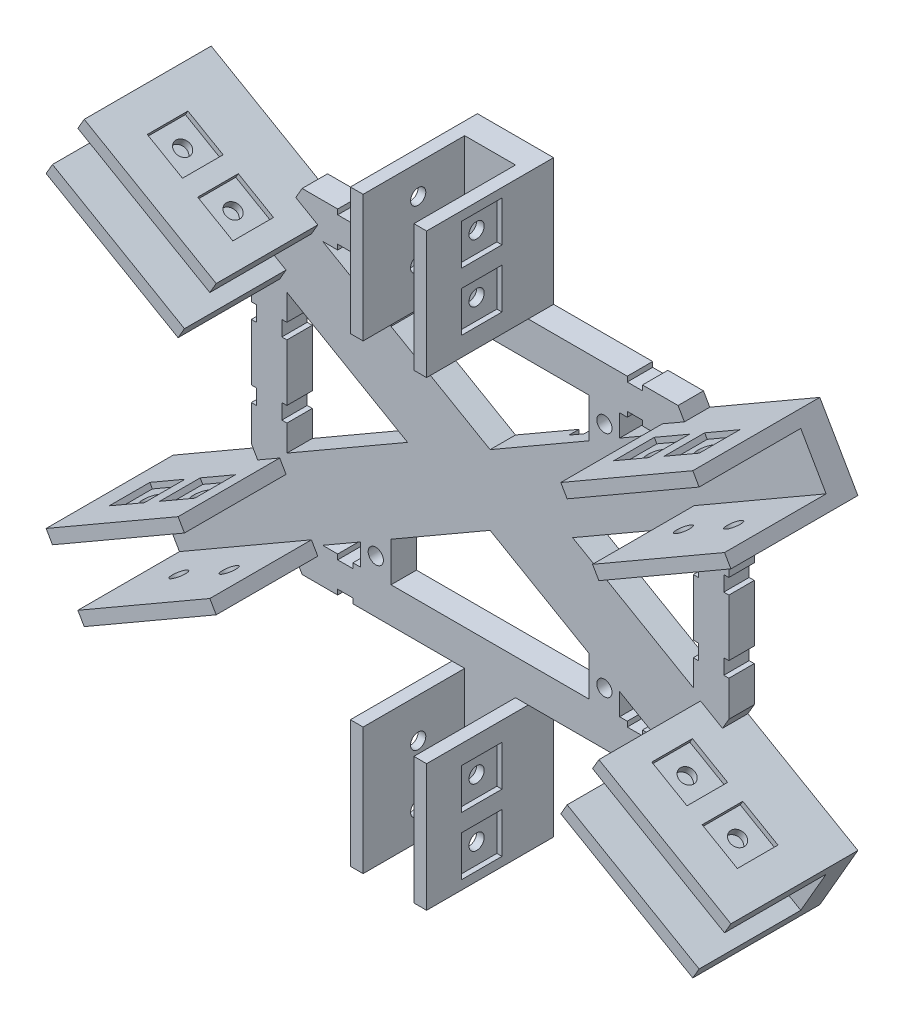
from build123d import *

# Parameters (mm, degrees)
ESQUISSE1_R                = 1.5
BOSS_EXTRU_2_DEPTH         = 5
ENL_V_MAT_EXTRU_2_DEPTH    = 2
ESQUISSE5_W                = 20
ESQUISSE5_H                = 2.5
BOSS_EXTRU_3_DEPTH         = 30
ESQUISSE7_W                = 20
ESQUISSE7_H                = 2.5
BOSS_EXTRU_4_DEPTH         = 30
ESQUISSE8_W                = 8
ESQUISSE8_H                = 8
ENL_V_MAT_EXTRU_3_DEPTH    = 1
ESQUISSE9_W                = 8
ESQUISSE9_H                = 8
ENL_V_MAT_EXTRU_4_DEPTH    = 1
ESQUISSE10_R               = 1.5
ENL_V_MAT_EXTRU_5_DEPTH    = 3
SYM_TRIE5_COPY_1_SKETCH_R  = 1.5
SYM_TRIE5_COPY_1_DEPTH     = 3
SYM_TRIE7_COPY_1_SKETCH_R  = 1.5
SYM_TRIE7_COPY_1_DEPTH     = 3
SYM_TRIE7_COPY_2_SKETCH_W  = 8
SYM_TRIE7_COPY_2_SKETCH_H  = 8
SYM_TRIE7_COPY_2_DEPTH     = 1
SYM_TRIE7_COPY_3_SKETCH_W  = 8
SYM_TRIE7_COPY_3_SKETCH_H  = 8
SYM_TRIE7_COPY_3_DEPTH     = 1
SYM_TRIE7_COPY_4_SKETCH_R  = 1.5
SYM_TRIE7_COPY_4_DEPTH     = 3
SYM_TRIE7_COPY_5_SKETCH_R  = 1.5
SYM_TRIE7_COPY_5_DEPTH     = 3
SYM_TRIE8_COPY_1_SKETCH_R  = 1.5
SYM_TRIE8_COPY_1_DEPTH     = 3
SYM_TRIE8_COPY_2_SKETCH_W  = 8
SYM_TRIE8_COPY_2_SKETCH_H  = 8
SYM_TRIE8_COPY_2_DEPTH     = 1
SYM_TRIE8_COPY_3_SKETCH_W  = 8
SYM_TRIE8_COPY_3_SKETCH_H  = 8
SYM_TRIE8_COPY_3_DEPTH     = 1
SYM_TRIE8_COPY_4_SKETCH_R  = 1.5
SYM_TRIE8_COPY_4_DEPTH     = 3
SYM_TRIE8_COPY_5_SKETCH_R  = 1.5
SYM_TRIE8_COPY_5_DEPTH     = 3
SYM_TRIE8_COPY_6_SKETCH_W  = 20
SYM_TRIE8_COPY_6_SKETCH_H  = 2.5
SYM_TRIE8_COPY_6_DEPTH     = 30
SYM_TRIE8_COPY_7_SKETCH_W  = 20
SYM_TRIE8_COPY_7_SKETCH_H  = 2.5
SYM_TRIE8_COPY_7_DEPTH     = 30
SYM_TRIE8_COPY_8_SKETCH_W  = 8
SYM_TRIE8_COPY_8_SKETCH_H  = 8
SYM_TRIE8_COPY_8_DEPTH     = 1
SYM_TRIE8_COPY_9_SKETCH_W  = 8
SYM_TRIE8_COPY_9_SKETCH_H  = 8
SYM_TRIE8_COPY_9_DEPTH     = 1
SYM_TRIE8_COPY_10_SKETCH_R = 1.5
SYM_TRIE8_COPY_10_DEPTH    = 3
SYM_TRIE8_COPY_11_SKETCH_R = 1.5
SYM_TRIE8_COPY_11_DEPTH    = 3
SYM_TRIE8_COPY_12_SKETCH_W = 8
SYM_TRIE8_COPY_12_SKETCH_H = 8
SYM_TRIE8_COPY_12_DEPTH    = 1
SYM_TRIE8_COPY_13_SKETCH_W = 8
SYM_TRIE8_COPY_13_SKETCH_H = 8
SYM_TRIE8_COPY_13_DEPTH    = 1
SYM_TRIE8_COPY_14_SKETCH_R = 1.5
SYM_TRIE8_COPY_14_DEPTH    = 3
SYM_TRIE8_COPY_15_SKETCH_R = 1.5
SYM_TRIE8_COPY_15_DEPTH    = 3
ESQUISSE11_W               = 2.5
ESQUISSE11_H               = 20
BOSS_EXTRU_5_DEPTH         = 25
ESQUISSE50_W               = 8
ESQUISSE50_H               = 8
ENL_V_MAT_EXTRU_25_DEPTH   = 1
ESQUISSE52_W               = 8
ESQUISSE52_H               = 8
ENL_V_MAT_EXTRU_26_DEPTH   = 1
ESQUISSE54_R               = 1.5
ENL_V_MAT_EXTRU_27_DEPTH   = 3
SYM_TRIE10_COPY_1_SKETCH_R = 1.5
SYM_TRIE10_COPY_1_DEPTH    = 3
SYM_TRIE11_COPY_1_SKETCH_R = 1.5
SYM_TRIE11_COPY_1_DEPTH    = 3
SYM_TRIE11_COPY_2_SKETCH_W = 2.5
SYM_TRIE11_COPY_2_SKETCH_H = 20
SYM_TRIE11_COPY_2_DEPTH    = 25
SYM_TRIE11_COPY_3_SKETCH_W = 8
SYM_TRIE11_COPY_3_SKETCH_H = 8
SYM_TRIE11_COPY_3_DEPTH    = 1
SYM_TRIE11_COPY_4_SKETCH_W = 8
SYM_TRIE11_COPY_4_SKETCH_H = 8
SYM_TRIE11_COPY_4_DEPTH    = 1
SYM_TRIE11_COPY_5_SKETCH_R = 1.5
SYM_TRIE11_COPY_5_DEPTH    = 3
SYM_TRIE11_COPY_6_SKETCH_R = 1.5
SYM_TRIE11_COPY_6_DEPTH    = 3
ENL_V_MAT_EXTRU_28_DEPTH   = 50


with BuildPart() as part:
    # Esquisse1 → Boss.-Extru.2 (new body)
    with BuildSketch(Plane.XY):
        Polygon((-27, -32.908965344), (-27, -31.908965344), (-30, -31.908965344), (-30, -32.908965344), (-37, -32.908965344), (-38.250062729, -30.743793185), (-59.900697824, -43.243793185), (-67.400697824, -30.253412128), (-45.750062729, -17.753412128), (-47, -15.588457268), (-47, -8.588457268), (-46, -8.588457268), (-46, -5.588457268), (-47, -5.588457268), (-47, 5.588457268), (-46, 5.588457268), (-46, 8.588457268), (-47, 8.588457268), (-47, 15.588457268), (-45.750062729, 17.753412128), (-67.400697824, 30.253412128), (-59.900697824, 43.243793185), (-38.250062729, 30.743793185), (-37, 32.908965344), (-30, 32.908965344), (-30, 31.908965344), (-27, 31.908965344), (-27, 32.908965344), (-7.5, 32.908965344), (-7.5, 57.908965344), (7.5, 57.908965344), (7.5, 32.908965344), (27, 32.908965344), (27, 31.908965344), (30, 31.908965344), (30, 32.908965344), (37, 32.908965344), (38.250062729, 30.743793185), (59.900697824, 43.243793185), (67.400697824, 30.253412128), (45.750062729, 17.753412128), (47, 15.588457268), (47, 8.588457268), (46, 8.588457268), (46, 5.588457268), (47, 5.588457268), (47, -5.588457268), (46, -5.588457268), (46, -8.588457268), (47, -8.588457268), (47, -15.588457268), (45.750062729, -17.753412128), (67.400697824, -30.253412128), (59.900697824, -43.243793185), (38.250062729, -30.743793185), (37, -32.908965344), (30, -32.908965344), (30, -31.908965344), (27, -31.908965344), (27, -32.908965344), (7.5, -32.908965344), (7.5, -57.908965344), (-7.5, -57.908965344), (-7.5, -32.908965344), align=None)
        with Locations((22.5, 22.5)):
            Circle(ESQUISSE1_R, mode=Mode.SUBTRACT)
        with Locations((-22.5, 22.5)):
            Circle(ESQUISSE1_R, mode=Mode.SUBTRACT)
        with Locations((22.5, -22.5)):
            Circle(ESQUISSE1_R, mode=Mode.SUBTRACT)
        with Locations((-22.5, -22.5)):
            Circle(ESQUISSE1_R, mode=Mode.SUBTRACT)
        Polygon((-40, 5.588457268), (-40, -5.588457268), (-41, -5.588457268), (-41, -8.588457268), (-40, -8.588457268), (-40, -13.712812921), (-16.248711306, 0), (-40, 13.712812921), (-40, 8.588457268), (-41, 8.588457268), (-41, 5.588457268), align=None, mode=Mode.SUBTRACT)
        Polygon((40, 13.712812921), (16.248711306, 0), (40, -13.712812921), (40, -8.588457268), (41, -8.588457268), (41, -5.588457268), (40, -5.588457268), (40, 5.588457268), (41, 5.588457268), (41, 8.588457268), (40, 8.588457268), align=None, mode=Mode.SUBTRACT)
        Polygon((-32.958548116, -25.908965344), (-30, -25.908965344), (-30, -26.908965344), (-27, -26.908965344), (-27, -25.908965344), (-25.5, -25.908965344), (-25.5, -21.602770581), align=None, mode=Mode.SUBTRACT)
        Polygon((19.5, -25.908965344), (0, -25.908965344), (-19.5, -25.908965344), (-19.5, -18.138668966), (0, -6.880338717), (19.5, -18.138668966), align=None, mode=Mode.SUBTRACT)
        Polygon((-27, 26.908965344), (-27, 25.908965344), (-25.5, 25.908965344), (-25.5, 21.602770581), (-32.958548116, 25.908965344), (-30, 25.908965344), (-30, 26.908965344), align=None, mode=Mode.SUBTRACT)
        Polygon((32.958548116, 25.908965344), (25.5, 21.602770581), (25.5, 25.908965344), (27, 25.908965344), (27, 26.908965344), (30, 26.908965344), (30, 25.908965344), align=None, mode=Mode.SUBTRACT)
        Polygon((27, -26.908965344), (27, -25.908965344), (25.5, -25.908965344), (25.5, -21.602770581), (32.958548116, -25.908965344), (30, -25.908965344), (30, -26.908965344), align=None, mode=Mode.SUBTRACT)
        Polygon((-19.5, 25.908965344), (-19.5, 18.138668966), (0, 6.880338717), (19.5, 18.138668966), (19.5, 25.908965344), (0, 25.908965344), align=None, mode=Mode.SUBTRACT)
    extrude(amount=BOSS_EXTRU_2_DEPTH)

    # Esquisse4 → Enlèv. mat.-Extru.2 (cut)
    with BuildSketch(Plane(origin=(0, 0, 0), x_dir=(-1, 0, 0), z_dir=(0, 0, -1))):
        Polygon((-22.5, 20.142891012), (-20.458683737, 21.321445506), (-20.458683737, 23.678554494), (-22.5, 24.857108988), (-24.541316263, 23.678554494), (-24.541316263, 21.321445506), align=None)
        Polygon((24.541316263, 21.321445506), (22.5, 20.142891012), (20.458683737, 21.321445506), (20.458683737, 23.678554494), (22.5, 24.857108988), (24.541316263, 23.678554494), align=None)
        Polygon((22.5, -20.142891012), (20.458683737, -21.321445506), (20.458683737, -23.678554494), (22.5, -24.857108988), (24.541316263, -23.678554494), (24.541316263, -21.321445506), align=None)
        Polygon((-24.541316263, -21.321445506), (-22.5, -20.142891012), (-20.458683737, -21.321445506), (-20.458683737, -23.678554494), (-22.5, -24.857108988), (-24.541316263, -23.678554494), align=None)
    extrude(amount=-ENL_V_MAT_EXTRU_2_DEPTH, mode=Mode.SUBTRACT)

    # Esquisse5 → Boss.-Extru.3 (add)
    with BuildSketch(Plane(origin=(63.650635095, 36.748711306, 0), x_dir=(0, 0, -1), z_dir=(0.8660254037844382, 0.500000000000001, 0))):
        with Locations((-15, -6.250125458)):
            Rectangle(ESQUISSE5_W, ESQUISSE5_H)
    boss_extru_3 = extrude(amount=-BOSS_EXTRU_3_DEPTH)

    # Esquisse7 → Boss.-Extru.4 (add)
    with BuildSketch(Plane(origin=(63.650635095, 36.748711306, 0), x_dir=(0, 0, -1), z_dir=(0.866025403784438, 0.5000000000000009, 0))):
        with Locations((-15, 6.249874542)):
            Rectangle(ESQUISSE7_W, ESQUISSE7_H)
    boss_extru_4 = extrude(amount=-BOSS_EXTRU_4_DEPTH)

    # Esquisse8 → Enlèv. mat.-Extru.3 (cut)
    with BuildSketch(Plane(origin=(3.750062729, -6.495299178, 0), x_dir=(0.8660254037844448, 0.4999999999999891, 0), z_dir=(0.4999999999999892, -0.8660254037844449, 0))):
        with Locations((51.610954886, 14.155470703)):
            Rectangle(ESQUISSE8_W, ESQUISSE8_H)
    enl_v_mat_extru_3 = extrude(amount=-ENL_V_MAT_EXTRU_3_DEPTH, mode=Mode.SUBTRACT)

    # Esquisse9 → Enlèv. mat.-Extru.4 (cut)
    with BuildSketch(Plane(origin=(3.750062729, -6.495299178, 0), x_dir=(0.8660254037844448, 0.4999999999999891, 0), z_dir=(0.4999999999999892, -0.8660254037844449, 0))):
        with Locations((63.062795122, 14.155470703)):
            Rectangle(ESQUISSE9_W, ESQUISSE9_H)
    enl_v_mat_extru_4 = extrude(amount=-ENL_V_MAT_EXTRU_4_DEPTH, mode=Mode.SUBTRACT)

    # Esquisse10 → Enlèv. mat.-Extru.5 (cut)
    with BuildSketch(Plane(origin=(3.250062729, -5.629273774, 0), x_dir=(0.8660254037844448, 0.49999999999998934, 0), z_dir=(0.4999999999999894, -0.8660254037844449, 0))):
        with Locations((51.610954886, 14.155470703)):
            Circle(ESQUISSE10_R)
    enl_v_mat_extru_5 = extrude(amount=-ENL_V_MAT_EXTRU_5_DEPTH, mode=Mode.SUBTRACT)

    # Symétrie4: Enlèv. mat.-Extru.5 across plane
    add(enl_v_mat_extru_5.mirror(Plane(origin=(49.655190327, 28.668437502, 0), x_dir=(0, 0, 1), z_dir=(-0.8660254037844448, -0.4999999999999891, 0))), mode=Mode.SUBTRACT)

    # Symétrie5: Enlèv. mat.-Extru.3, Enlèv. mat.-Extru.4, Enlèv. mat.-Extru.5 across plane
    add(enl_v_mat_extru_3.mirror(Plane(origin=(6.2729e-05, -0.00010865, 0), x_dir=(0, 0, 1), z_dir=(-0.5000000000000009, 0.8660254037844383, 0))), mode=Mode.SUBTRACT)
    add(enl_v_mat_extru_4.mirror(Plane(origin=(6.2729e-05, -0.00010865, 0), x_dir=(0, 0, 1), z_dir=(-0.5000000000000009, 0.8660254037844383, 0))), mode=Mode.SUBTRACT)
    add(enl_v_mat_extru_5.mirror(Plane(origin=(6.2729e-05, -0.00010865, 0), x_dir=(0, 0, 1), z_dir=(-0.5000000000000009, 0.8660254037844383, 0))), mode=Mode.SUBTRACT)

    # Symétrie5 copy 1 sketch → Symétrie5 copy 1 (cut)
    with BuildSketch(Plane(origin=(96.060443383, 62.965931479, 0), x_dir=(-0.8660254037844315, -0.5000000000000128, 1.001543065824766e-15), z_dir=(-0.500000000000013, 0.8660254037844318, 0))):
        with Locations((51.610954886, 14.155470703)):
            Circle(SYM_TRIE5_COPY_1_SKETCH_R)
    extrude(amount=-SYM_TRIE5_COPY_1_DEPTH, mode=Mode.SUBTRACT)

    # Symétrie7: Boss.-Extru.3, Boss.-Extru.4, Enlèv. mat.-Extru.3, Enlèv. mat.-Extru.4, Enlèv. mat.-Extru.5 across plane
    add(boss_extru_3.mirror(Plane.ZX))
    add(boss_extru_4.mirror(Plane.ZX))
    add(enl_v_mat_extru_3.mirror(Plane.ZX), mode=Mode.SUBTRACT)
    add(enl_v_mat_extru_4.mirror(Plane.ZX), mode=Mode.SUBTRACT)
    add(enl_v_mat_extru_5.mirror(Plane.ZX), mode=Mode.SUBTRACT)

    # Symétrie7 copy 1 sketch → Symétrie7 copy 1 (cut)
    with BuildSketch(Plane(origin=(102.560443383, -51.70760123, 0), x_dir=(-0.866025403784445, 0.49999999999998906, 1.001543065824766e-15), z_dir=(0.4999999999999891, 0.8660254037844451, 0))):
        with Locations((51.610954886, 14.155470703)):
            Circle(SYM_TRIE7_COPY_1_SKETCH_R)
    extrude(amount=-SYM_TRIE7_COPY_1_DEPTH, mode=Mode.SUBTRACT)

    # Symétrie7 copy 2 sketch → Symétrie7 copy 2 (cut)
    with BuildSketch(Plane(origin=(-3.749937271, -6.495081879, 0), x_dir=(0.8660254037844313, -0.5000000000000124, 0), z_dir=(-0.5000000000000128, -0.8660254037844318, 0))):
        with Locations((51.610954886, 14.155470703)):
            Rectangle(SYM_TRIE7_COPY_2_SKETCH_W, SYM_TRIE7_COPY_2_SKETCH_H)
    extrude(amount=-SYM_TRIE7_COPY_2_DEPTH, mode=Mode.SUBTRACT)

    # Symétrie7 copy 3 sketch → Symétrie7 copy 3 (cut)
    with BuildSketch(Plane(origin=(-3.749937271, -6.495081879, 0), x_dir=(0.8660254037844313, -0.5000000000000124, 0), z_dir=(-0.5000000000000128, -0.8660254037844318, 0))):
        with Locations((63.062795122, 14.155470703)):
            Rectangle(SYM_TRIE7_COPY_3_SKETCH_W, SYM_TRIE7_COPY_3_SKETCH_H)
    extrude(amount=-SYM_TRIE7_COPY_3_DEPTH, mode=Mode.SUBTRACT)

    # Symétrie7 copy 4 sketch → Symétrie7 copy 4 (cut)
    with BuildSketch(Plane(origin=(-3.249937271, -5.629056475, 0), x_dir=(0.8660254037844315, -0.5000000000000123, 0), z_dir=(-0.5000000000000127, -0.866025403784432, 0))):
        with Locations((51.610954886, 14.155470703)):
            Circle(SYM_TRIE7_COPY_4_SKETCH_R)
    extrude(amount=-SYM_TRIE7_COPY_4_DEPTH, mode=Mode.SUBTRACT)

    # Symétrie7 copy 5 sketch → Symétrie7 copy 5 (cut)
    with BuildSketch(Plane(origin=(96.060443383, -62.965931479, 0), x_dir=(-0.8660254037844315, 0.5000000000000128, 1.001543065824766e-15), z_dir=(-0.500000000000013, -0.8660254037844318, 0))):
        with Locations((51.610954886, -14.155470703)):
            Circle(SYM_TRIE7_COPY_5_SKETCH_R)
    extrude(amount=-SYM_TRIE7_COPY_5_DEPTH, mode=Mode.SUBTRACT)

    # Symétrie8: Boss.-Extru.3, Boss.-Extru.4, Enlèv. mat.-Extru.3, Enlèv. mat.-Extru.4, Enlèv. mat.-Extru.5 across plane
    add(boss_extru_3.mirror(Plane(origin=(0, 0, 0), x_dir=(0, 0, 1), z_dir=(1, 0, 0))))
    add(boss_extru_4.mirror(Plane(origin=(0, 0, 0), x_dir=(0, 0, 1), z_dir=(1, 0, 0))))
    add(enl_v_mat_extru_3.mirror(Plane(origin=(0, 0, 0), x_dir=(0, 0, 1), z_dir=(1, 0, 0))), mode=Mode.SUBTRACT)
    add(enl_v_mat_extru_4.mirror(Plane(origin=(0, 0, 0), x_dir=(0, 0, 1), z_dir=(1, 0, 0))), mode=Mode.SUBTRACT)
    add(enl_v_mat_extru_5.mirror(Plane(origin=(0, 0, 0), x_dir=(0, 0, 1), z_dir=(1, 0, 0))), mode=Mode.SUBTRACT)

    # Symétrie8 copy 1 sketch → Symétrie8 copy 1 (cut)
    with BuildSketch(Plane(origin=(-102.560443383, 51.70760123, 0), x_dir=(0.866025403784445, -0.49999999999998906, 1.001543065824766e-15), z_dir=(-0.4999999999999891, -0.8660254037844451, 0))):
        with Locations((51.610954886, 14.155470703)):
            Circle(SYM_TRIE8_COPY_1_SKETCH_R)
    extrude(amount=-SYM_TRIE8_COPY_1_DEPTH, mode=Mode.SUBTRACT)

    # Symétrie8 copy 2 sketch → Symétrie8 copy 2 (cut)
    with BuildSketch(Plane(origin=(3.749937271, 6.495081879, 0), x_dir=(-0.8660254037844313, 0.5000000000000124, 0), z_dir=(0.5000000000000128, 0.8660254037844318, 0))):
        with Locations((51.610954886, 14.155470703)):
            Rectangle(SYM_TRIE8_COPY_2_SKETCH_W, SYM_TRIE8_COPY_2_SKETCH_H)
    extrude(amount=-SYM_TRIE8_COPY_2_DEPTH, mode=Mode.SUBTRACT)

    # Symétrie8 copy 3 sketch → Symétrie8 copy 3 (cut)
    with BuildSketch(Plane(origin=(3.749937271, 6.495081879, 0), x_dir=(-0.8660254037844313, 0.5000000000000124, 0), z_dir=(0.5000000000000128, 0.8660254037844318, 0))):
        with Locations((63.062795122, 14.155470703)):
            Rectangle(SYM_TRIE8_COPY_3_SKETCH_W, SYM_TRIE8_COPY_3_SKETCH_H)
    extrude(amount=-SYM_TRIE8_COPY_3_DEPTH, mode=Mode.SUBTRACT)

    # Symétrie8 copy 4 sketch → Symétrie8 copy 4 (cut)
    with BuildSketch(Plane(origin=(3.249937271, 5.629056475, 0), x_dir=(-0.8660254037844315, 0.5000000000000123, 0), z_dir=(0.5000000000000127, 0.866025403784432, 0))):
        with Locations((51.610954886, 14.155470703)):
            Circle(SYM_TRIE8_COPY_4_SKETCH_R)
    extrude(amount=-SYM_TRIE8_COPY_4_DEPTH, mode=Mode.SUBTRACT)

    # Symétrie8 copy 5 sketch → Symétrie8 copy 5 (cut)
    with BuildSketch(Plane(origin=(-96.060443383, 62.965931479, 0), x_dir=(0.8660254037844315, -0.5000000000000128, 1.001543065824766e-15), z_dir=(0.500000000000013, 0.8660254037844318, 0))):
        with Locations((51.610954886, -14.155470703)):
            Circle(SYM_TRIE8_COPY_5_SKETCH_R)
    extrude(amount=-SYM_TRIE8_COPY_5_DEPTH, mode=Mode.SUBTRACT)

    # Symétrie8 copy 6 sketch → Symétrie8 copy 6 (add)
    with BuildSketch(Plane(origin=(-63.650635095, -36.748711306, 0), x_dir=(0, 0, -1), z_dir=(-0.8660254037844382, -0.500000000000001, 0))):
        with Locations((-15, -6.250125458)):
            Rectangle(SYM_TRIE8_COPY_6_SKETCH_W, SYM_TRIE8_COPY_6_SKETCH_H)
    extrude(amount=-SYM_TRIE8_COPY_6_DEPTH)

    # Symétrie8 copy 7 sketch → Symétrie8 copy 7 (add)
    with BuildSketch(Plane(origin=(-63.650635095, -36.748711306, 0), x_dir=(0, 0, -1), z_dir=(-0.866025403784438, -0.5000000000000009, 0))):
        with Locations((-15, 6.249874542)):
            Rectangle(SYM_TRIE8_COPY_7_SKETCH_W, SYM_TRIE8_COPY_7_SKETCH_H)
    extrude(amount=-SYM_TRIE8_COPY_7_DEPTH)

    # Symétrie8 copy 8 sketch → Symétrie8 copy 8 (cut)
    with BuildSketch(Plane(origin=(-3.750062729, 6.495299178, 0), x_dir=(-0.8660254037844448, -0.4999999999999891, 0), z_dir=(-0.4999999999999892, 0.8660254037844449, 0))):
        with Locations((51.610954886, 14.155470703)):
            Rectangle(SYM_TRIE8_COPY_8_SKETCH_W, SYM_TRIE8_COPY_8_SKETCH_H)
    extrude(amount=-SYM_TRIE8_COPY_8_DEPTH, mode=Mode.SUBTRACT)

    # Symétrie8 copy 9 sketch → Symétrie8 copy 9 (cut)
    with BuildSketch(Plane(origin=(-3.750062729, 6.495299178, 0), x_dir=(-0.8660254037844448, -0.4999999999999891, 0), z_dir=(-0.4999999999999892, 0.8660254037844449, 0))):
        with Locations((63.062795122, 14.155470703)):
            Rectangle(SYM_TRIE8_COPY_9_SKETCH_W, SYM_TRIE8_COPY_9_SKETCH_H)
    extrude(amount=-SYM_TRIE8_COPY_9_DEPTH, mode=Mode.SUBTRACT)

    # Symétrie8 copy 10 sketch → Symétrie8 copy 10 (cut)
    with BuildSketch(Plane(origin=(-3.250062729, 5.629273774, 0), x_dir=(-0.8660254037844448, -0.49999999999998934, 0), z_dir=(-0.4999999999999894, 0.8660254037844449, 0))):
        with Locations((51.610954886, 14.155470703)):
            Circle(SYM_TRIE8_COPY_10_SKETCH_R)
    extrude(amount=-SYM_TRIE8_COPY_10_DEPTH, mode=Mode.SUBTRACT)

    # Symétrie8 copy 11 sketch → Symétrie8 copy 11 (cut)
    with BuildSketch(Plane(origin=(-102.560443383, -51.70760123, 0), x_dir=(0.866025403784445, 0.49999999999998906, 1.001543065824766e-15), z_dir=(-0.4999999999999891, 0.8660254037844451, 0))):
        with Locations((51.610954886, -14.155470703)):
            Circle(SYM_TRIE8_COPY_11_SKETCH_R)
    extrude(amount=-SYM_TRIE8_COPY_11_DEPTH, mode=Mode.SUBTRACT)

    # Symétrie8 copy 12 sketch → Symétrie8 copy 12 (cut)
    with BuildSketch(Plane(origin=(3.749937271, -6.495081879, 0), x_dir=(-0.8660254037844313, -0.5000000000000124, 0), z_dir=(0.5000000000000128, -0.8660254037844318, 0))):
        with Locations((51.610954886, -14.155470703)):
            Rectangle(SYM_TRIE8_COPY_12_SKETCH_W, SYM_TRIE8_COPY_12_SKETCH_H)
    extrude(amount=-SYM_TRIE8_COPY_12_DEPTH, mode=Mode.SUBTRACT)

    # Symétrie8 copy 13 sketch → Symétrie8 copy 13 (cut)
    with BuildSketch(Plane(origin=(3.749937271, -6.495081879, 0), x_dir=(-0.8660254037844313, -0.5000000000000124, 0), z_dir=(0.5000000000000128, -0.8660254037844318, 0))):
        with Locations((63.062795122, -14.155470703)):
            Rectangle(SYM_TRIE8_COPY_13_SKETCH_W, SYM_TRIE8_COPY_13_SKETCH_H)
    extrude(amount=-SYM_TRIE8_COPY_13_DEPTH, mode=Mode.SUBTRACT)

    # Symétrie8 copy 14 sketch → Symétrie8 copy 14 (cut)
    with BuildSketch(Plane(origin=(3.249937271, -5.629056475, 0), x_dir=(-0.8660254037844315, -0.5000000000000123, 0), z_dir=(0.5000000000000127, -0.866025403784432, 0))):
        with Locations((51.610954886, -14.155470703)):
            Circle(SYM_TRIE8_COPY_14_SKETCH_R)
    extrude(amount=-SYM_TRIE8_COPY_14_DEPTH, mode=Mode.SUBTRACT)

    # Symétrie8 copy 15 sketch → Symétrie8 copy 15 (cut)
    with BuildSketch(Plane(origin=(-96.060443383, -62.965931479, 0), x_dir=(0.8660254037844315, 0.5000000000000128, 1.001543065824766e-15), z_dir=(0.500000000000013, -0.8660254037844318, 0))):
        with Locations((51.610954886, 14.155470703)):
            Circle(SYM_TRIE8_COPY_15_SKETCH_R)
    extrude(amount=-SYM_TRIE8_COPY_15_DEPTH, mode=Mode.SUBTRACT)

    # Esquisse11 → Boss.-Extru.5 (add)
    with BuildSketch(Plane(origin=(0, 57.908965344, 0), x_dir=(1, 0, 0), z_dir=(0, 1, 0))):
        with Locations((-6.25, -15)):
            Rectangle(ESQUISSE11_W, ESQUISSE11_H)
    boss_extru_5 = extrude(amount=-BOSS_EXTRU_5_DEPTH)

    # Esquisse50 → Enlèv. mat.-Extru.25 (cut)
    with BuildSketch(Plane(origin=(-7.5, 26.517737728, -42.965253421), x_dir=(0, 0, 1), z_dir=(-1, 0, 0))):
        with Locations((57.125253421, 14.155470703)):
            Rectangle(ESQUISSE50_W, ESQUISSE50_H)
    enl_v_mat_extru_25 = extrude(amount=-ENL_V_MAT_EXTRU_25_DEPTH, mode=Mode.SUBTRACT)

    # Esquisse52 → Enlèv. mat.-Extru.26 (cut)
    with BuildSketch(Plane(origin=(-7.5, 26.517737728, -42.965253421), x_dir=(0, 0, 1), z_dir=(-1, 0, 0))):
        with Locations((57.125253421, 25.605470703)):
            Rectangle(ESQUISSE52_W, ESQUISSE52_H)
    enl_v_mat_extru_26 = extrude(amount=-ENL_V_MAT_EXTRU_26_DEPTH, mode=Mode.SUBTRACT)

    # Esquisse54 → Enlèv. mat.-Extru.27 (cut)
    with BuildSketch(Plane(origin=(-6.5, 26.517737728, -42.965253421), x_dir=(0, 0, 1), z_dir=(-1, 0, 0))):
        with Locations((57.125253421, 14.155470703)):
            Circle(ESQUISSE54_R)
    enl_v_mat_extru_27 = extrude(amount=-ENL_V_MAT_EXTRU_27_DEPTH, mode=Mode.SUBTRACT)

    # Symétrie9: Enlèv. mat.-Extru.27 across plane
    add(enl_v_mat_extru_27.mirror(Plane.ZX.offset(46.398208431)), mode=Mode.SUBTRACT)

    # Symétrie10: Boss.-Extru.5, Enlèv. mat.-Extru.25, Enlèv. mat.-Extru.26, Enlèv. mat.-Extru.27 across plane
    add(boss_extru_5.mirror(Plane.ZY))
    add(enl_v_mat_extru_25.mirror(Plane.ZY), mode=Mode.SUBTRACT)
    add(enl_v_mat_extru_26.mirror(Plane.ZY), mode=Mode.SUBTRACT)
    add(enl_v_mat_extru_27.mirror(Plane.ZY), mode=Mode.SUBTRACT)

    # Symétrie10 copy 1 sketch → Symétrie10 copy 1 (cut)
    with BuildSketch(Plane(origin=(6.5, 66.278679134, -42.965253421), x_dir=(0, 0, 1), z_dir=(1, 0, 0))):
        with Locations((57.125253421, 14.155470703)):
            Circle(SYM_TRIE10_COPY_1_SKETCH_R)
    extrude(amount=-SYM_TRIE10_COPY_1_DEPTH, mode=Mode.SUBTRACT)

    # Symétrie11: Boss.-Extru.5, Enlèv. mat.-Extru.25, Enlèv. mat.-Extru.26, Enlèv. mat.-Extru.27 across plane
    add(boss_extru_5.mirror(Plane.ZX))
    add(enl_v_mat_extru_25.mirror(Plane.ZX), mode=Mode.SUBTRACT)
    add(enl_v_mat_extru_26.mirror(Plane.ZX), mode=Mode.SUBTRACT)
    add(enl_v_mat_extru_27.mirror(Plane.ZX), mode=Mode.SUBTRACT)

    # Symétrie11 copy 1 sketch → Symétrie11 copy 1 (cut)
    with BuildSketch(Plane(origin=(-6.5, -66.278679134, -42.965253421), x_dir=(0, 0, 1), z_dir=(-1, 0, 0))):
        with Locations((57.125253421, 14.155470703)):
            Circle(SYM_TRIE11_COPY_1_SKETCH_R)
    extrude(amount=-SYM_TRIE11_COPY_1_DEPTH, mode=Mode.SUBTRACT)

    # Symétrie11 copy 2 sketch → Symétrie11 copy 2 (add)
    with BuildSketch(Plane(origin=(0, -57.908965344, 0), x_dir=(-1, 0, 0), z_dir=(0, -1, 0))):
        with Locations((-6.25, -15)):
            Rectangle(SYM_TRIE11_COPY_2_SKETCH_W, SYM_TRIE11_COPY_2_SKETCH_H)
    extrude(amount=-SYM_TRIE11_COPY_2_DEPTH)

    # Symétrie11 copy 3 sketch → Symétrie11 copy 3 (cut)
    with BuildSketch(Plane(origin=(7.5, -26.517737728, -42.965253421), x_dir=(0, 0, 1), z_dir=(1, 0, 0))):
        with Locations((57.125253421, 14.155470703)):
            Rectangle(SYM_TRIE11_COPY_3_SKETCH_W, SYM_TRIE11_COPY_3_SKETCH_H)
    extrude(amount=-SYM_TRIE11_COPY_3_DEPTH, mode=Mode.SUBTRACT)

    # Symétrie11 copy 4 sketch → Symétrie11 copy 4 (cut)
    with BuildSketch(Plane(origin=(7.5, -26.517737728, -42.965253421), x_dir=(0, 0, 1), z_dir=(1, 0, 0))):
        with Locations((57.125253421, 25.605470703)):
            Rectangle(SYM_TRIE11_COPY_4_SKETCH_W, SYM_TRIE11_COPY_4_SKETCH_H)
    extrude(amount=-SYM_TRIE11_COPY_4_DEPTH, mode=Mode.SUBTRACT)

    # Symétrie11 copy 5 sketch → Symétrie11 copy 5 (cut)
    with BuildSketch(Plane(origin=(6.5, -26.517737728, -42.965253421), x_dir=(0, 0, 1), z_dir=(1, 0, 0))):
        with Locations((57.125253421, 14.155470703)):
            Circle(SYM_TRIE11_COPY_5_SKETCH_R)
    extrude(amount=-SYM_TRIE11_COPY_5_DEPTH, mode=Mode.SUBTRACT)

    # Symétrie11 copy 6 sketch → Symétrie11 copy 6 (cut)
    with BuildSketch(Plane(origin=(6.5, -66.278679134, -42.965253421), x_dir=(0, 0, 1), z_dir=(1, 0, 0))):
        with Locations((57.125253421, -14.155470703)):
            Circle(SYM_TRIE11_COPY_6_SKETCH_R)
    extrude(amount=-SYM_TRIE11_COPY_6_DEPTH, mode=Mode.SUBTRACT)

    # Esquisse55 → Enlèv. mat.-Extru.28 (cut)
    with BuildSketch(Plane(origin=(0, -25.908965344, 0), x_dir=(0.8660254037844375, 1.849002583061117e-15, 0.5000000000000021), z_dir=(0, 1, 0))):
        Polygon((10.825317547, 6.25), (13.423393759, 7.75), (14.423393759, 6.017949192), (11.825317547, 4.517949192), align=None)
        Polygon((-13.423393759, -7.75), (-12.423393759, -9.482050808), (-9.825317547, -7.982050808), (-10.825317547, -6.25), align=None)
    extrude(amount=ENL_V_MAT_EXTRU_28_DEPTH, mode=Mode.SUBTRACT)


solid = part.part
